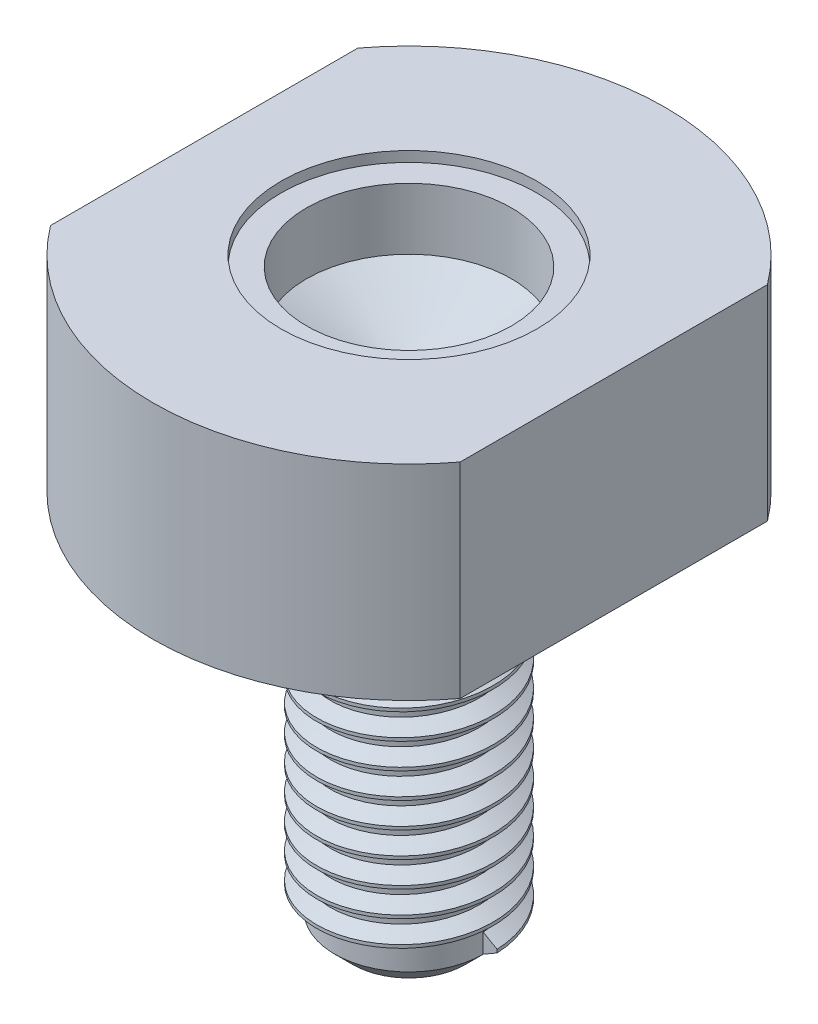
from build123d import *

# Parameters (mm, degrees)
SZKIC2_W                   = 1
SZKIC2_H                   = 4
WYTNIJ_WYCI_GNI_CIE1_DEPTH = 5
GWINT1_PITCH               = 0.5


with BuildPart() as part:
    # Szkic1 → Obrót1 (revolve)
    with BuildSketch(Plane.XY):
        Polygon((0, 9.05), (0, 0), (1.1, 0), (1.45, 0.35), (1.45, 4.95), (1.1, 4.95), (1.1, 7.45), (5, 7.45), (5, 11.45), (2.5, 11.45), (2.5, 11.25), (2, 11.25), (2, 10.05), align=None)
    revolve(axis=Axis((0, 0, 0), (0, 1, 0)))

    # Szkic2 → Wytnij-wyciągnięcie1 (cut, symmetric)
    with BuildSketch(Plane.XY):
        with Locations((-4.5, 9.45)):
            Rectangle(SZKIC2_W, SZKIC2_H)
        with Locations((4.5, 9.45)):
            Rectangle(SZKIC2_W, SZKIC2_H)
    extrude(amount=WYTNIJ_WYCI_GNI_CIE1_DEPTH, both=True, mode=Mode.SUBTRACT)

    # Gwint1: the profile of Profil gwintu2 profile screwed along a right-hand helix of 9.2 turns, 6 arcs to a turn; built about Z, then put on its axis
    gwint1_z = Axis((0, 0, 0), (0, 0, 1))
    gwint1_corners = [(1.4497, 0, -0.000173205), (1.720632938, 0, 0.156249999), (1.720632938, 0, 0.218749999), (1.4497, 0, 0.375173204)]
    with BuildLine(mode=Mode.PRIVATE) as gwint1_profile:
        Line(gwint1_corners[0], gwint1_corners[1])
        Line(gwint1_corners[1], gwint1_corners[2])
        Line(gwint1_corners[2], gwint1_corners[3])
        Line(gwint1_corners[3], gwint1_corners[0])
    gwint1_cap = Face(gwint1_profile.wire())
    gwint1_turn_angles = [0, 30, 60, 90, 120, 150, 180, 210, 240, 270, 300, 330, 360]
    gwint1_turn_weights = [1, 0.8660254037844387, 1, 0.8660254037844387, 1, 0.8660254037844387, 1, 0.8660254037844387, 1, 0.8660254037844387, 1, 0.8660254037844387, 1]
    gwint1_turn_rails = [Edge.make_bspline([Vector(p[0], p[1], 0).rotate(gwint1_z, gwint1_turn_angles[k]) / gwint1_turn_weights[k] + Vector(0, 0, p[2] + GWINT1_PITCH * gwint1_turn_angles[k] / 360) for k in range(13)], [0, 0, 0, 1, 1, 2, 2, 3, 3, 4, 4, 5, 5, 6, 6, 6], 2, gwint1_turn_weights) for p in gwint1_corners]
    gwint1_turn_sides = [Face.make_surface_from_curves(gwint1_turn_rails[p[0]], gwint1_turn_rails[p[1]]) for p in [(0, 1), (1, 2), (2, 3), (3, 0)]]
    gwint1_last_angles = [3240, 3270, 3300, 3306, 3312]
    gwint1_last_weights = [1, 0.8660254037844387, 1, 0.9945218953682737, 1]
    gwint1_last_rails = [Edge.make_bspline([Vector(p[0], p[1], 0).rotate(gwint1_z, gwint1_last_angles[k]) / gwint1_last_weights[k] + Vector(0, 0, p[2] + GWINT1_PITCH * gwint1_last_angles[k] / 360) for k in range(5)], [0, 0, 0, 1, 1, 2, 2, 2], 2, gwint1_last_weights) for p in gwint1_corners]
    gwint1_last_sides = [Face.make_surface_from_curves(gwint1_last_rails[p[0]], gwint1_last_rails[p[1]]) for p in [(0, 1), (1, 2), (2, 3), (3, 0)]]
    gwint1 = Plane(origin=(0, 0.35, 0), x_dir=(1, 0, 0), z_dir=(0, 1, 0)) * Solid(Shell([*[p.moved(Location((0, 0, GWINT1_PITCH * i))) for i in range(9) for p in gwint1_turn_sides], *gwint1_last_sides, gwint1_cap, gwint1_cap.rotate(gwint1_z, 3312).moved(Location((0, 0, GWINT1_PITCH * 3312 / 360)))]))
    add(gwint1)


solid = part.part
